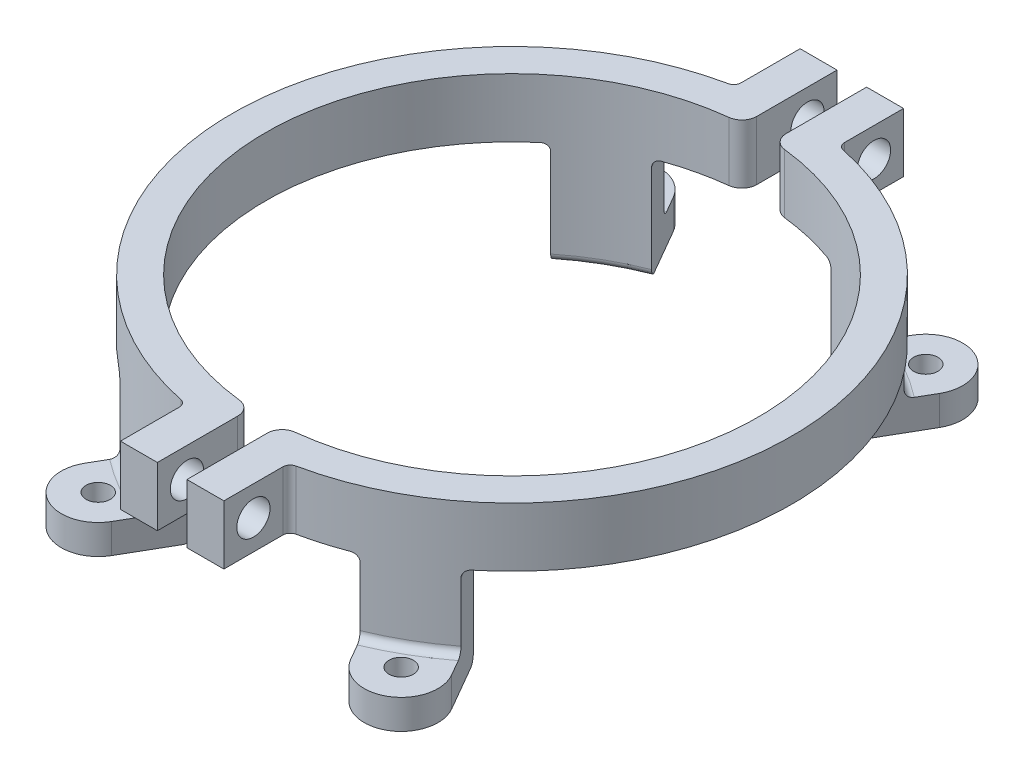
from build123d import *
from build123d.topology import SkipClean

# Parameters (mm, degrees)
EXTRUDE_1_DEPTH             = 11
EXTRUDE_1_2_DEPTH           = 11
CUT_EXTRUDE_2_DEPTH         = 18
CUT_EXTRUDE_START           = -14
CUT_EXTRUDE_3_DEPTH         = 14
CUT_EXTRUDE_1_DEPTH         = 61.577409156
CUT_EXTRUDE_1_DEPTH_BACK    = 61.577409156
SKETCH_2_R                  = 2.25
SKETCH_6_W                  = 1.65
SKETCH_6_H                  = 22
HOLE_WIZARD_M4_1_AT_2_COUNT = 2
HOLE_WIZARD_M4_1_AT_2_PITCH = 71.01408311
HOLE_WIZARD_M4_1_AT_3_COUNT = 2
HOLE_WIZARD_M4_1_AT_3_PITCH = 41
HOLE_WIZARD_M4_1_AT_4_COUNT = 2
HOLE_WIZARD_M4_1_AT_4_PITCH = 82
FILLET_1_R                  = 1
FILLET_2_R                  = 1
FILLET_3_R                  = 1
FILLET_4_R                  = 1


with BuildPart() as part:
    # 草图1 → 凸台-拉伸1 (new, symmetric)
    with BuildSketch(Plane(origin=(0, 0, 0), x_dir=(1, 0, 0), z_dir=(0, 1, 0))):
        with BuildLine():
            Line((-7, 38.017397333), (-7, 46))
            Line((-7, 46), (-2, 46))
            Line((-2, 46), (-2, 35.122962574))
            ThreePointArc((-2, 35.122962574), (-2.507918117, 33.791162419), (-3.773691655, 33.13580769))
            ThreePointArc((-3.773691655, 33.13580769), (-33.35, 0), (-3.773691655, -33.13580769))
            ThreePointArc((-3.773691655, -33.13580769), (-2.507918117, -33.791162419), (-2, -35.122962574))
            Line((-2, -35.122962574), (-2, -46))
            Line((-2, -46), (-7, -46))
            Line((-7, -46), (-7, -38.017397333))
            ThreePointArc((-7, -38.017397333), (-7.223494943, -37.387286314), (-7.794079794, -37.038828547))
            ThreePointArc((-7.794079794, -37.038828547), (-11.158590141, -36.167780773), (-14.42902075, -34.991797042))
            Line((-14.42902075, -34.991797042), (-16.169872981, -38.007041555))
            ThreePointArc((-16.169872981, -38.007041555), (-23, -39.837168574), (-24.830127019, -33.007041555))
            Line((-24.830127019, -33.007041555), (-23.089274787, -29.991797042))
            ThreePointArc((-23.089274787, -29.991797042), (-37.85, 0), (-23.089274787, 29.991797042))
            Line((-23.089274787, 29.991797042), (-24.830127019, 33.007041555))
            ThreePointArc((-24.830127019, 33.007041555), (-23, 39.837168574), (-16.169872981, 38.007041555))
            Line((-16.169872981, 38.007041555), (-14.42902075, 34.991797042))
            ThreePointArc((-14.42902075, 34.991797042), (-11.158590141, 36.167780773), (-7.794079794, 37.038828547))
            ThreePointArc((-7.794079794, 37.038828547), (-7.223494943, 37.387286314), (-7, 38.017397333))
        make_face()
    extrude(amount=EXTRUDE_1_DEPTH, both=True)


with BuildPart() as body_2:
    # 草图1 → Extrude 1 2 (new, symmetric)
    with BuildSketch(Plane(origin=(0, 0, 0), x_dir=(1, 0, 0), z_dir=(0, 1, 0))):
        with BuildLine():
            Line((2, 46), (2, 35.122962574))
            ThreePointArc((2, 35.122962574), (2.507918117, 33.791162419), (3.773691655, 33.13580769))
            ThreePointArc((3.773691655, 33.13580769), (33.35, 0), (3.773691655, -33.13580769))
            ThreePointArc((3.773691655, -33.13580769), (2.507918117, -33.791162419), (2, -35.122962574))
            Line((2, -35.122962574), (2, -46))
            Line((2, -46), (7, -46))
            Line((7, -46), (7, -38.017397333))
            ThreePointArc((7, -38.017397333), (7.223494943, -37.387286314), (7.794079794, -37.038828547))
            ThreePointArc((7.794079794, -37.038828547), (11.158590141, -36.167780773), (14.42902075, -34.991797042))
            Line((14.42902075, -34.991797042), (16.169872981, -38.007041555))
            ThreePointArc((16.169872981, -38.007041555), (23, -39.837168574), (24.830127019, -33.007041555))
            Line((24.830127019, -33.007041555), (23.089274787, -29.991797042))
            ThreePointArc((23.089274787, -29.991797042), (37.85, 0), (23.089274787, 29.991797042))
            Line((23.089274787, 29.991797042), (24.830127019, 33.007041555))
            ThreePointArc((24.830127019, 33.007041555), (23, 39.837168574), (16.169872981, 38.007041555))
            Line((16.169872981, 38.007041555), (14.42902075, 34.991797042))
            ThreePointArc((14.42902075, 34.991797042), (11.158590141, 36.167780773), (7.794079794, 37.038828547))
            ThreePointArc((7.794079794, 37.038828547), (7.223494943, 37.387286314), (7, 38.017397333))
            Line((7, 38.017397333), (7, 46))
            Line((7, 46), (2, 46))
        make_face()
    extrude(amount=EXTRUDE_1_2_DEPTH, both=True)


with BuildPart() as cut_extrude_2_tool:
    # 草图3 → 切除-拉伸2 (new body)
    with SkipClean():  # the faces are left unmerged after this step: merging them gives an invalid solid
        with BuildSketch(Plane(origin=(0, 11, 0), x_dir=(1, 0, 0), z_dir=(0, 1, 0))):
            with BuildLine():
                Line((-16.169872981, -38.007041555), (-14.42902075, -34.991797042))
                ThreePointArc((-14.42902075, -34.991797042), (-18.925, -32.779061533), (-23.089274787, -29.991797042))
                Line((-23.089274787, -29.991797042), (-24.830127019, -33.007041555))
                ThreePointArc((-24.830127019, -33.007041555), (-23, -39.837168574), (-16.169872981, -38.007041555))
            make_face()
            with BuildLine():
                Line((-23.089274787, 29.991797042), (-24.830127019, 33.007041555))
                ThreePointArc((-24.830127019, 33.007041555), (-23, 39.837168574), (-16.169872981, 38.007041555))
                Line((-16.169872981, 38.007041555), (-14.42902075, 34.991797042))
                ThreePointArc((-14.42902075, 34.991797042), (-18.925, 32.779061533), (-23.089274787, 29.991797042))
            make_face()
            with BuildLine():
                Line((16.169872981, 38.007041555), (14.42902075, 34.991797042))
                ThreePointArc((14.42902075, 34.991797042), (18.925, 32.779061533), (23.089274787, 29.991797042))
                Line((23.089274787, 29.991797042), (24.830127019, 33.007041555))
                ThreePointArc((24.830127019, 33.007041555), (23, 39.837168574), (16.169872981, 38.007041555))
            make_face()
            with BuildLine():
                Line((23.089274787, -29.991797042), (24.830127019, -33.007041555))
                ThreePointArc((24.830127019, -33.007041555), (23, -39.837168574), (16.169872981, -38.007041555))
                Line((16.169872981, -38.007041555), (14.42902075, -34.991797042))
                ThreePointArc((14.42902075, -34.991797042), (18.925, -32.779061533), (23.089274787, -29.991797042))
            make_face()
        extrude(amount=-CUT_EXTRUDE_2_DEPTH)


with BuildPart() as part_1:
    with SkipClean():  # the faces are left unmerged after this step: merging them gives an invalid solid
        add(part.part)

        # 切除-拉伸2: cut by cut_extrude_2_tool
        add(cut_extrude_2_tool.part, mode=Mode.SUBTRACT)


with BuildPart() as body_2_1:
    with SkipClean():  # the faces are left unmerged after this step: merging them gives an invalid solid
        add(body_2.part)

        # 切除-拉伸2: cut by cut_extrude_2_tool
        add(cut_extrude_2_tool.part, mode=Mode.SUBTRACT)


with BuildPart() as cut_extrude_3_tool:
    # 草图4 → 切除-拉伸3 (new body)
    with BuildSketch(Plane.XZ.offset(11).offset(CUT_EXTRUDE_START)):
        with BuildLine():
            Line((20.81665561, -26.055505161), (23.089274787, -29.991797042))
            ThreePointArc((23.089274787, -29.991797042), (37.85, 0), (23.089274787, 29.991797042))
            Line((23.089274787, 29.991797042), (20.81665561, 26.055505161))
            ThreePointArc((20.81665561, 26.055505161), (33.35, 0), (20.81665561, -26.055505161))
        make_face()
        with BuildLine():
            Line((12.156401573, 31.055505161), (14.42902075, 34.991797042))
            ThreePointArc((14.42902075, 34.991797042), (11.158590141, 36.167780773), (7.794079794, 37.038828547))
            ThreePointArc((7.794079794, 37.038828547), (7.223494943, 37.387286314), (7, 38.017397333))
            Line((7, 38.017397333), (7, 46))
            Line((7, 46), (2, 46))
            Line((2, 46), (2, 35.122962574))
            ThreePointArc((2, 35.122962574), (2.507918117, 33.791162419), (3.773691655, 33.13580769))
            ThreePointArc((3.773691655, 33.13580769), (8.032675906, 32.368172914), (12.156401573, 31.055505161))
        make_face()
        with BuildLine():
            Line((2, -46), (2, -35.122962574))
            ThreePointArc((2, -35.122962574), (2.507918117, -33.791162419), (3.773691655, -33.13580769))
            ThreePointArc((3.773691655, -33.13580769), (8.032675906, -32.368172914), (12.156401573, -31.055505161))
            Line((12.156401573, -31.055505161), (14.42902075, -34.991797042))
            ThreePointArc((14.42902075, -34.991797042), (11.158590141, -36.167780773), (7.794079794, -37.038828547))
            ThreePointArc((7.794079794, -37.038828547), (7.223494943, -37.387286314), (7, -38.017397333))
            Line((7, -38.017397333), (7, -46))
            Line((7, -46), (2, -46))
        make_face()
        with BuildLine():
            Line((-14.42902075, -34.991797042), (-12.156401573, -31.055505161))
            ThreePointArc((-12.156401573, -31.055505161), (-8.032675906, -32.368172914), (-3.773691655, -33.13580769))
            ThreePointArc((-3.773691655, -33.13580769), (-2.507918117, -33.791162419), (-2, -35.122962574))
            Line((-2, -35.122962574), (-2, -46))
            Line((-2, -46), (-7, -46))
            Line((-7, -46), (-7, -38.017397333))
            ThreePointArc((-7, -38.017397333), (-7.223494943, -37.387286314), (-7.794079794, -37.038828547))
            ThreePointArc((-7.794079794, -37.038828547), (-11.158590141, -36.167780773), (-14.42902075, -34.991797042))
        make_face()
        with BuildLine():
            Line((-2, 35.122962574), (-2, 46))
            Line((-2, 46), (-7, 46))
            Line((-7, 46), (-7, 38.017397333))
            ThreePointArc((-7, 38.017397333), (-7.223494943, 37.387286314), (-7.794079794, 37.038828547))
            ThreePointArc((-7.794079794, 37.038828547), (-11.158590141, 36.167780773), (-14.42902075, 34.991797042))
            Line((-14.42902075, 34.991797042), (-12.156401573, 31.055505161))
            ThreePointArc((-12.156401573, 31.055505161), (-8.032675906, 32.368172914), (-3.773691655, 33.13580769))
            ThreePointArc((-3.773691655, 33.13580769), (-2.507918117, 33.791162419), (-2, 35.122962574))
        make_face()
        with BuildLine():
            Line((-23.089274787, 29.991797042), (-20.81665561, 26.055505161))
            ThreePointArc((-20.81665561, 26.055505161), (-33.35, 0), (-20.81665561, -26.055505161))
            Line((-20.81665561, -26.055505161), (-23.089274787, -29.991797042))
            ThreePointArc((-23.089274787, -29.991797042), (-37.85, 0), (-23.089274787, 29.991797042))
        make_face()
    extrude(amount=CUT_EXTRUDE_3_DEPTH)


with BuildPart() as part_2:
    add(part_1.part)

    # 切除-拉伸3: cut by cut_extrude_3_tool
    add(cut_extrude_3_tool.part, mode=Mode.SUBTRACT)


with BuildPart() as body_2_2:
    add(body_2_1.part)

    # 切除-拉伸3: cut by cut_extrude_3_tool
    add(cut_extrude_3_tool.part, mode=Mode.SUBTRACT)


with BuildPart() as cut_extrude_1_tool:
    # 草图2 → 切除-拉伸1 (new, two sides: drawn at the far end of the back side and taken through both)
    with BuildSketch(Plane(origin=(0, 0, 0), x_dir=(0, 0, -1), z_dir=(1, 0, 0)).offset(-CUT_EXTRUDE_1_DEPTH_BACK)):
        with Locations((-42, 7)):
            Circle(SKETCH_2_R)
        with Locations((42, 7)):
            Circle(SKETCH_2_R)
    extrude(amount=CUT_EXTRUDE_1_DEPTH + CUT_EXTRUDE_1_DEPTH_BACK)


with BuildPart() as part_3:
    add(part_2.part)

    # 切除-拉伸1: cut by cut_extrude_1_tool
    add(cut_extrude_1_tool.part, mode=Mode.SUBTRACT)


with BuildPart() as body_2_3:
    add(body_2_2.part)

    # 切除-拉伸1: cut by cut_extrude_1_tool
    add(cut_extrude_1_tool.part, mode=Mode.SUBTRACT)

    # 草图6 → M4 螺纹孔1 (revolve, cut)
    with BuildSketch(Plane(origin=(20.5, -11, -35.507041555), x_dir=(0, 0, -1), z_dir=(1, 0, 0))):
        with Locations((0.825, 11)):
            Rectangle(SKETCH_6_W, SKETCH_6_H)
    hole_wizard_m4_1 = revolve(axis=Axis((20.5, -17.35, -35.507041555), (0, 1, 0)), mode=Mode.SUBTRACT)

    # M4 螺纹孔1 at 2: M4 螺纹孔1 ×2
    with Locations(*[(0, 0, i * HOLE_WIZARD_M4_1_AT_2_PITCH) for i in range(1, HOLE_WIZARD_M4_1_AT_2_COUNT)]):
        add(hole_wizard_m4_1, mode=Mode.SUBTRACT)

    # 圆角1
    # the kernel refuses this fillet: 1 mm, written as the material it adds along each edge
    with BuildSketch(Plane(origin=(19.56665561, 3, -23.890441652), x_dir=(0.8660254037844459, 0, 0.49999999999998734), z_dir=(0.4999999999999874, 0, -0.8660254037844459))) as fillet_1_piece_1_section:
        with BuildLine():
            CenterArc((FILLET_1_R, FILLET_1_R), FILLET_1_R, 180, 90)
            Line((0, FILLET_1_R), (0, 0))
            Line((0, 0), (FILLET_1_R, 0))
        make_face()
    fillet_1_piece_1 = extrude(amount=9.545238354, mode=Mode.PRIVATE)
    fillet_1_piece_1 = fillet_1_piece_1 - Plane(origin=(0, 2.773722258, 0), x_dir=(0.11315417256011422, 0, -0.9935774419904247), z_dir=(0, 1, 0)) * Cylinder(33.35, 24, mode=Mode.PRIVATE)
    fillet_1_piece_1 = fillet_1_piece_1 & Plane(origin=(0, 2.773722258, 0), x_dir=(0.2059202059202099, 0, 0.9785687859286022), z_dir=(0, 1, 0)) * Cylinder(37.85, 24, mode=Mode.PRIVATE)
    add(fillet_1_piece_1)
    with BuildSketch(Plane(origin=(24.339274787, 3, 32.156860551), x_dir=(0, -1, 0), z_dir=(-0.4999999999999987, 0, -0.8660254037844394))) as fillet_1_piece_2_section:
        with BuildLine():
            CenterArc((FILLET_1_R, -FILLET_1_R), FILLET_1_R, 90, 90)
            Line((0, -FILLET_1_R), (0, 0))
            Line((0, 0), (FILLET_1_R, 0))
        make_face()
    fillet_1_piece_2 = extrude(amount=9.545238354, mode=Mode.PRIVATE)
    fillet_1_piece_2 = fillet_1_piece_2 - Plane(origin=(0, 2.773722759, 0), x_dir=(0.11315417256011422, 0, -0.9935774419904247), z_dir=(0, 1, 0)) * Cylinder(33.35, 24, mode=Mode.PRIVATE)
    fillet_1_piece_2 = fillet_1_piece_2 & Plane(origin=(0, 2.773722759, 0), x_dir=(0.2059202059202099, 0, 0.9785687859286022), z_dir=(0, 1, 0)) * Cylinder(37.85, 24, mode=Mode.PRIVATE)
    add(fillet_1_piece_2)
    with BuildSketch(Plane(origin=(10.906401573, 3, 28.890441652), x_dir=(-0.8660254037844409, 0, 0.4999999999999961), z_dir=(0.49999999999999606, 0, 0.8660254037844409))) as fillet_1_piece_3_section:
        with BuildLine():
            CenterArc((FILLET_1_R, FILLET_1_R), FILLET_1_R, 180, 90)
            Line((0, FILLET_1_R), (0, 0))
            Line((0, 0), (FILLET_1_R, 0))
        make_face()
    fillet_1_piece_3 = extrude(amount=9.545238354, mode=Mode.PRIVATE)
    fillet_1_piece_3 = fillet_1_piece_3 - Plane(origin=(0, 2.773722258, 0), x_dir=(0.11315417256011422, 0, -0.9935774419904247), z_dir=(0, 1, 0)) * Cylinder(33.35, 24, mode=Mode.PRIVATE)
    fillet_1_piece_3 = fillet_1_piece_3 & Plane(origin=(0, 2.773722258, 0), x_dir=(0.2059202059202099, 0, 0.9785687859286022), z_dir=(0, 1, 0)) * Cylinder(37.85, 24, mode=Mode.PRIVATE)
    add(fillet_1_piece_3)
    with BuildSketch(Plane(origin=(10.906401573, 3, -28.890441652), x_dir=(-0.8660254037844403, 0, -0.49999999999999734), z_dir=(0.49999999999999734, 0, -0.8660254037844403))) as fillet_1_piece_4_section:
        with BuildLine():
            CenterArc((FILLET_1_R, -FILLET_1_R), FILLET_1_R, 90, 90)
            Line((0, -FILLET_1_R), (0, 0))
            Line((0, 0), (FILLET_1_R, 0))
        make_face()
    fillet_1_piece_4 = extrude(amount=9.545238354, mode=Mode.PRIVATE)
    fillet_1_piece_4 = fillet_1_piece_4 - Plane(origin=(0, 2.773722914, 0), x_dir=(0.11315417256011422, 0, -0.9935774419904247), z_dir=(0, 1, 0)) * Cylinder(33.35, 24, mode=Mode.PRIVATE)
    fillet_1_piece_4 = fillet_1_piece_4 & Plane(origin=(0, 2.773722914, 0), x_dir=(0.2059202059202099, 0, 0.9785687859286022), z_dir=(0, 1, 0)) * Cylinder(37.85, 24, mode=Mode.PRIVATE)
    add(fillet_1_piece_4)
    # the kernel refuses this fillet: 1 mm, written as the material it takes off along each edge
    with BuildSketch(Plane(origin=(0, -11, 0), x_dir=(0.2937453502491662, 0, -0.9558837111317436), z_dir=(-0.9558837111317436, 0, -0.2937453502491662))) as fillet_1_2_piece_1:
        with BuildLine():
            CenterArc((33.35 + FILLET_1_R, -FILLET_1_R), FILLET_1_R, 90, 90)
            Line((33.35 + FILLET_1_R, 0), (33.35, 0))
            Line((33.35, 0), (33.35, -FILLET_1_R))
        make_face()
    revolve(axis=Axis((0, -11, 0), (0, -1, 0)), revolution_arc=25.835363346, mode=Mode.SUBTRACT)
    with BuildSketch(Plane(origin=(0, -11, 0), x_dir=(0.6809469017792498, 0, 0.7323327911252102), z_dir=(0.7323327911252102, 0, -0.6809469017792498))) as fillet_1_2_piece_2:
        with BuildLine():
            CenterArc((33.35 + FILLET_1_R, -FILLET_1_R), FILLET_1_R, 90, 90)
            Line((33.35 + FILLET_1_R, 0), (33.35, 0))
            Line((33.35, 0), (33.35, -FILLET_1_R))
        make_face()
    revolve(axis=Axis((0, -11, 0), (0, -1, 0)), revolution_arc=25.835363346, mode=Mode.SUBTRACT)

    # 圆角4
    fillet_4_edges = [body_2_3.edges().sort_by_distance(p)[0] for p in [
        (18.925, -7, -32.779061533),
        (18.925, -7, 32.779061533),
    ]]
    fillet(fillet_4_edges, radius=FILLET_4_R)


with BuildPart() as part_4:
    add(part_3.part)

    # M4 螺纹孔1 at 3: M4 螺纹孔1 ×2
    with Locations(*[(-i * HOLE_WIZARD_M4_1_AT_3_PITCH, 0, 0) for i in range(1, HOLE_WIZARD_M4_1_AT_3_COUNT)]):
        add(hole_wizard_m4_1, mode=Mode.SUBTRACT)

    # M4 螺纹孔1 at 4: M4 螺纹孔1 ×2
    with Locations(*[Vector(-0.4999999999999985, 0, 0.8660254037844396) * (i * HOLE_WIZARD_M4_1_AT_4_PITCH) for i in range(1, HOLE_WIZARD_M4_1_AT_4_COUNT)]):
        add(hole_wizard_m4_1, mode=Mode.SUBTRACT)

    # 圆角2
    fillet_2_edges = [part_4.edges().sort_by_distance(p)[0] for p in [
        (-16.675, -11, 28.881947216),
        (-16.675, -11, -28.881947216),
        (-21.952965199, 3, -28.023651101),
        (-21.952965199, 3, 28.023651101),
        (-13.292711161, 3, -33.023651101),
        (-13.292711161, 3, 33.023651101),
    ]]
    fillet(fillet_2_edges, radius=FILLET_2_R)

    # 圆角3
    fillet_3_edges = [part_4.edges().sort_by_distance(p)[0] for p in [
        (-18.925, -7, 32.779061533),
        (-18.925, -7, -32.779061533),
    ]]
    fillet(fillet_3_edges, radius=FILLET_3_R)


solid = Compound([body_2_3.part, part_4.part])
